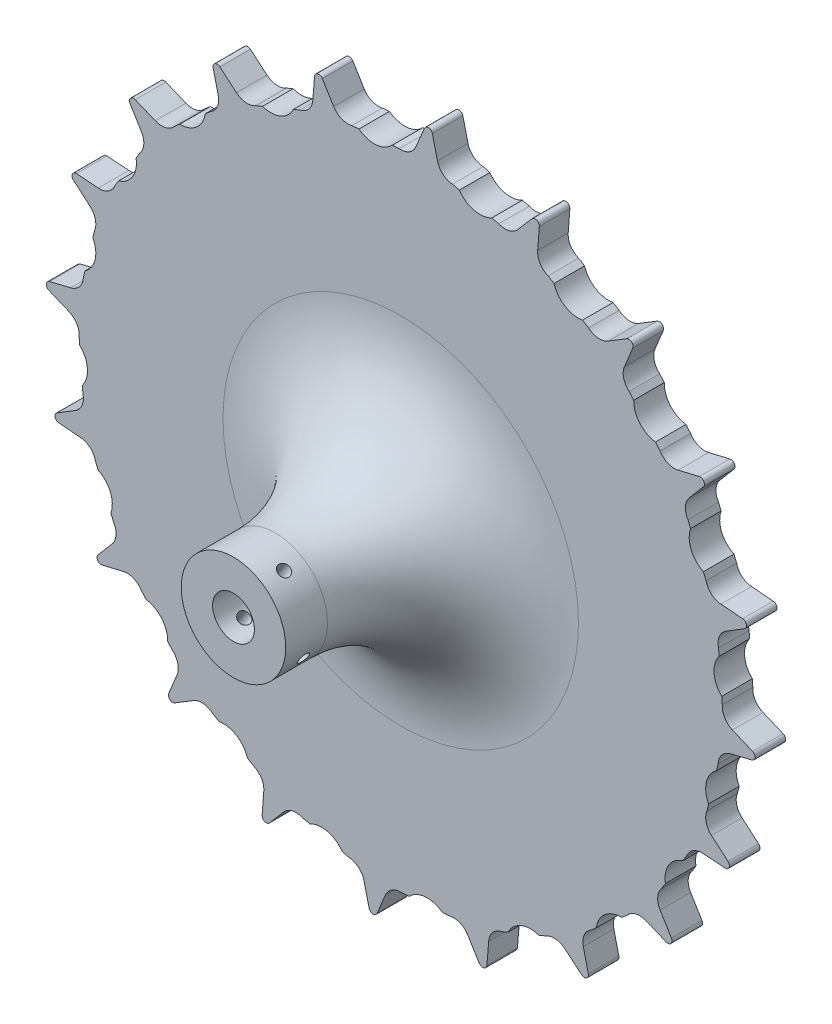
from build123d import *

# Parameters (mm, degrees)
BOSS_EXTRUDE1_DEPTH                 = 7.3
SKETCH2_R                           = 12.5
BOSS_EXTRUDE2_DEPTH                 = 40
FILLET1_R                           = 30
SKETCH3_R                           = 5
CUT_EXTRUDE1_DEPTH                  = 129.838593424
F_1_0MM_DOWEL_HOLE1_D               = 2.8
F_1_0MM_DOWEL_HOLE1_DEPTH           = 33.158795133
F_1_0MM_DOWEL_HOLE1_TIP             = 0.841204867
F_1_0MM_DOWEL_HOLE1_ON_FACE_2_D     = 2.8
F_1_0MM_DOWEL_HOLE1_ON_FACE_2_DEPTH = 33.158795133
F_1_0MM_DOWEL_HOLE1_ON_FACE_2_TIP   = 0.841204867
CUT_EXTRUDE2_DEPTH                  = 10
CIRPATTERN1_COUNT                   = 20


with BuildPart() as part:
    # Sketch1 → Boss-Extrude1 (new body)
    with BuildSketch(Plane.XY):
        with BuildLine():
            ThreePointArc((3.662609618, 79.321514688), (0, 76.88125), (-3.662609618, 79.321514688))
            Line((-3.662609618, 79.321514688), (-5.667701775, 84.126186191))
            ThreePointArc((-5.667701775, 84.126186191), (-6.669023137, 84.737973367), (-7.562311971, 83.977077135))
            Line((-7.562311971, 83.977077135), (-8.791101901, 78.917893592))
            ThreePointArc((-8.791101901, 78.917893592), (-12.026877215, 75.934714235), (-16.026135532, 77.77197684))
            Line((-16.026135532, 77.77197684), (-18.758157894, 82.203829344))
            ThreePointArc((-18.758157894, 82.203829344), (-19.842855928, 82.651443234), (-20.606116499, 81.760173735))
            Line((-20.606116499, 81.760173735), (-21.028347314, 76.571052042))
            ThreePointArc((-21.028347314, 76.571052042), (-23.757612799, 73.118413793), (-27.995044802, 74.307434811))
            Line((-27.995044802, 74.307434811), (-31.386725911, 78.2573414))
            ThreePointArc((-31.386725911, 78.2573414), (-32.528091751, 78.529760263), (-33.142530051, 77.530063512))
            Line((-33.142530051, 77.530063512), (-32.747805028, 72.338777067))
            ThreePointArc((-32.747805028, 72.338777067), (-34.903357108, 68.501695338), (-39.274623159, 69.013197125))
            Line((-39.274623159, 69.013197125), (-43.242448569, 72.38389799))
            ThreePointArc((-43.242448569, 72.38389799), (-44.412378001, 72.47441397), (-44.862864519, 71.390905818))
            Line((-44.862864519, 71.390905818), (-43.660903098, 66.325281321))
            ThreePointArc((-43.660903098, 66.325281321), (-45.189664928, 62.198237799), (-49.587129948, 62.019625484))
            Line((-49.587129948, 62.019625484), (-54.03339863, 64.728122783))
            ThreePointArc((-54.03339863, 64.728122783), (-55.203084108, 64.634507076), (-55.478526372, 63.49386709))
            Line((-55.478526372, 63.49386709), (-53.498924832, 58.678637028))
            ThreePointArc((-53.498924832, 58.678637028), (-54.363253221, 54.363253221), (-58.678637028, 53.498924832))
            Line((-58.678637028, 53.498924832), (-63.49386709, 55.478526372))
            ThreePointArc((-63.49386709, 55.478526372), (-64.634507076, 55.203084108), (-64.728122783, 54.03339863))
            Line((-64.728122783, 54.03339863), (-62.019625484, 49.587129948))
            ThreePointArc((-62.019625484, 49.587129948), (-62.198237799, 45.189664928), (-66.325281321, 43.660903098))
            Line((-66.325281321, 43.660903098), (-71.390905818, 44.862864519))
            ThreePointArc((-71.390905818, 44.862864519), (-72.47441397, 44.412378001), (-72.38389799, 43.242448569))
            Line((-72.38389799, 43.242448569), (-69.013197125, 39.274623159))
            ThreePointArc((-69.013197125, 39.274623159), (-68.501695338, 34.903357108), (-72.338777067, 32.747805028))
            Line((-72.338777067, 32.747805028), (-77.530063512, 33.142530051))
            ThreePointArc((-77.530063512, 33.142530051), (-78.529760263, 32.528091751), (-78.2573414, 31.386725911))
            Line((-78.2573414, 31.386725911), (-74.307434811, 27.995044802))
            ThreePointArc((-74.307434811, 27.995044802), (-73.118413793, 23.757612799), (-76.571052042, 21.028347314))
            Line((-76.571052042, 21.028347314), (-81.760173735, 20.606116499))
            ThreePointArc((-81.760173735, 20.606116499), (-82.651443234, 19.842855928), (-82.203829344, 18.758157894))
            Line((-82.203829344, 18.758157894), (-77.77197684, 16.026135532))
            ThreePointArc((-77.77197684, 16.026135532), (-75.934714235, 12.026877215), (-78.917893592, 8.791101901))
            Line((-78.917893592, 8.791101901), (-83.977077135, 7.562311971))
            ThreePointArc((-83.977077135, 7.562311971), (-84.737973367, 6.669023137), (-84.126186191, 5.667701775))
            Line((-84.126186191, 5.667701775), (-79.321514688, 3.662609618))
            ThreePointArc((-79.321514688, 3.662609618), (-76.88125, 0), (-79.321514688, -3.662609618))
            Line((-79.321514688, -3.662609618), (-84.126186191, -5.667701775))
            ThreePointArc((-84.126186191, -5.667701775), (-84.737973367, -6.669023137), (-83.977077135, -7.562311971))
            Line((-83.977077135, -7.562311971), (-78.917893592, -8.791101901))
            ThreePointArc((-78.917893592, -8.791101901), (-75.934714235, -12.026877215), (-77.77197684, -16.026135532))
            Line((-77.77197684, -16.026135532), (-82.203829344, -18.758157894))
            ThreePointArc((-82.203829344, -18.758157894), (-82.651443234, -19.842855928), (-81.760173735, -20.606116499))
            Line((-81.760173735, -20.606116499), (-76.571052042, -21.028347314))
            ThreePointArc((-76.571052042, -21.028347314), (-73.118413793, -23.757612799), (-74.307434811, -27.995044802))
            Line((-74.307434811, -27.995044802), (-78.2573414, -31.386725911))
            ThreePointArc((-78.2573414, -31.386725911), (-78.529760263, -32.528091751), (-77.530063512, -33.142530051))
            Line((-77.530063512, -33.142530051), (-72.338777067, -32.747805028))
            ThreePointArc((-72.338777067, -32.747805028), (-68.501695338, -34.903357108), (-69.013197125, -39.274623159))
            Line((-69.013197125, -39.274623159), (-72.38389799, -43.242448569))
            ThreePointArc((-72.38389799, -43.242448569), (-72.47441397, -44.412378001), (-71.390905818, -44.862864519))
            Line((-71.390905818, -44.862864519), (-66.325281321, -43.660903098))
            ThreePointArc((-66.325281321, -43.660903098), (-62.198237799, -45.189664928), (-62.019625484, -49.587129948))
            Line((-62.019625484, -49.587129948), (-64.728122783, -54.03339863))
            ThreePointArc((-64.728122783, -54.03339863), (-64.634507076, -55.203084108), (-63.49386709, -55.478526372))
            Line((-63.49386709, -55.478526372), (-58.678637028, -53.498924832))
            ThreePointArc((-58.678637028, -53.498924832), (-54.363253221, -54.363253221), (-53.498924832, -58.678637028))
            Line((-53.498924832, -58.678637028), (-55.478526372, -63.49386709))
            ThreePointArc((-55.478526372, -63.49386709), (-55.203084108, -64.634507076), (-54.03339863, -64.728122783))
            Line((-54.03339863, -64.728122783), (-49.587129948, -62.019625484))
            ThreePointArc((-49.587129948, -62.019625484), (-45.189664928, -62.198237799), (-43.660903098, -66.325281321))
            Line((-43.660903098, -66.325281321), (-44.862864519, -71.390905818))
            ThreePointArc((-44.862864519, -71.390905818), (-44.412378001, -72.47441397), (-43.242448569, -72.38389799))
            Line((-43.242448569, -72.38389799), (-39.274623159, -69.013197125))
            ThreePointArc((-39.274623159, -69.013197125), (-34.903357108, -68.501695338), (-32.747805028, -72.338777067))
            Line((-32.747805028, -72.338777067), (-33.142530051, -77.530063512))
            ThreePointArc((-33.142530051, -77.530063512), (-32.528091751, -78.529760263), (-31.386725911, -78.2573414))
            Line((-31.386725911, -78.2573414), (-27.995044802, -74.307434811))
            ThreePointArc((-27.995044802, -74.307434811), (-23.757612799, -73.118413793), (-21.028347314, -76.571052042))
            Line((-21.028347314, -76.571052042), (-20.606116499, -81.760173735))
            ThreePointArc((-20.606116499, -81.760173735), (-19.842855928, -82.651443234), (-18.758157894, -82.203829344))
            Line((-18.758157894, -82.203829344), (-16.026135532, -77.77197684))
            ThreePointArc((-16.026135532, -77.77197684), (-12.026877215, -75.934714235), (-8.791101901, -78.917893592))
            Line((-8.791101901, -78.917893592), (-7.562311971, -83.977077135))
            ThreePointArc((-7.562311971, -83.977077135), (-6.669023137, -84.737973367), (-5.667701775, -84.126186191))
            Line((-5.667701775, -84.126186191), (-3.662609618, -79.321514688))
            ThreePointArc((-3.662609618, -79.321514688), (0, -76.88125), (3.662609618, -79.321514688))
            Line((3.662609618, -79.321514688), (5.667701775, -84.126186191))
            ThreePointArc((5.667701775, -84.126186191), (6.669023137, -84.737973367), (7.562311971, -83.977077135))
            Line((7.562311971, -83.977077135), (8.791101901, -78.917893592))
            ThreePointArc((8.791101901, -78.917893592), (12.026877215, -75.934714235), (16.026135532, -77.77197684))
            Line((16.026135532, -77.77197684), (18.758157894, -82.203829344))
            ThreePointArc((18.758157894, -82.203829344), (19.842855928, -82.651443234), (20.606116499, -81.760173735))
            Line((20.606116499, -81.760173735), (21.028347314, -76.571052042))
            ThreePointArc((21.028347314, -76.571052042), (23.757612799, -73.118413793), (27.995044802, -74.307434811))
            Line((27.995044802, -74.307434811), (31.386725911, -78.2573414))
            ThreePointArc((31.386725911, -78.2573414), (32.528091751, -78.529760263), (33.142530051, -77.530063512))
            Line((33.142530051, -77.530063512), (32.747805028, -72.338777067))
            ThreePointArc((32.747805028, -72.338777067), (34.903357108, -68.501695338), (39.274623159, -69.013197125))
            Line((39.274623159, -69.013197125), (43.242448569, -72.38389799))
            ThreePointArc((43.242448569, -72.38389799), (44.412378001, -72.47441397), (44.862864519, -71.390905818))
            Line((44.862864519, -71.390905818), (43.660903098, -66.325281321))
            ThreePointArc((43.660903098, -66.325281321), (45.189664928, -62.198237799), (49.587129948, -62.019625484))
            Line((49.587129948, -62.019625484), (54.03339863, -64.728122783))
            ThreePointArc((54.03339863, -64.728122783), (55.203084108, -64.634507076), (55.478526372, -63.49386709))
            Line((55.478526372, -63.49386709), (53.498924832, -58.678637028))
            ThreePointArc((53.498924832, -58.678637028), (54.363253221, -54.363253221), (58.678637028, -53.498924832))
            Line((58.678637028, -53.498924832), (63.49386709, -55.478526372))
            ThreePointArc((63.49386709, -55.478526372), (64.634507076, -55.203084108), (64.728122783, -54.03339863))
            Line((64.728122783, -54.03339863), (62.019625484, -49.587129948))
            ThreePointArc((62.019625484, -49.587129948), (62.198237799, -45.189664928), (66.325281321, -43.660903098))
            Line((66.325281321, -43.660903098), (71.390905818, -44.862864519))
            ThreePointArc((71.390905818, -44.862864519), (72.47441397, -44.412378001), (72.38389799, -43.242448569))
            Line((72.38389799, -43.242448569), (69.013197125, -39.274623159))
            ThreePointArc((69.013197125, -39.274623159), (68.501695338, -34.903357108), (72.338777067, -32.747805028))
            Line((72.338777067, -32.747805028), (77.530063512, -33.142530051))
            ThreePointArc((77.530063512, -33.142530051), (78.529760263, -32.528091751), (78.2573414, -31.386725911))
            Line((78.2573414, -31.386725911), (74.307434811, -27.995044802))
            ThreePointArc((74.307434811, -27.995044802), (73.118413793, -23.757612799), (76.571052042, -21.028347314))
            Line((76.571052042, -21.028347314), (81.760173735, -20.606116499))
            ThreePointArc((81.760173735, -20.606116499), (82.651443234, -19.842855928), (82.203829344, -18.758157894))
            Line((82.203829344, -18.758157894), (77.77197684, -16.026135532))
            ThreePointArc((77.77197684, -16.026135532), (75.934714235, -12.026877215), (78.917893592, -8.791101901))
            Line((78.917893592, -8.791101901), (83.977077135, -7.562311971))
            ThreePointArc((83.977077135, -7.562311971), (84.737973367, -6.669023137), (84.126186191, -5.667701775))
            Line((84.126186191, -5.667701775), (79.321514688, -3.662609618))
            ThreePointArc((79.321514688, -3.662609618), (76.88125, 0), (79.321514688, 3.662609618))
            Line((79.321514688, 3.662609618), (84.126186191, 5.667701775))
            ThreePointArc((84.126186191, 5.667701775), (84.737973367, 6.669023137), (83.977077135, 7.562311971))
            Line((83.977077135, 7.562311971), (78.917893592, 8.791101901))
            ThreePointArc((78.917893592, 8.791101901), (75.934714235, 12.026877215), (77.77197684, 16.026135532))
            Line((77.77197684, 16.026135532), (82.203829344, 18.758157894))
            ThreePointArc((82.203829344, 18.758157894), (82.651443234, 19.842855928), (81.760173735, 20.606116499))
            Line((81.760173735, 20.606116499), (76.571052042, 21.028347314))
            ThreePointArc((76.571052042, 21.028347314), (73.118413793, 23.757612799), (74.307434811, 27.995044802))
            Line((74.307434811, 27.995044802), (78.2573414, 31.386725911))
            ThreePointArc((78.2573414, 31.386725911), (78.529760263, 32.528091751), (77.530063512, 33.142530051))
            Line((77.530063512, 33.142530051), (72.338777067, 32.747805028))
            ThreePointArc((72.338777067, 32.747805028), (68.501695338, 34.903357108), (69.013197125, 39.274623159))
            Line((69.013197125, 39.274623159), (72.38389799, 43.242448569))
            ThreePointArc((72.38389799, 43.242448569), (72.47441397, 44.412378001), (71.390905818, 44.862864519))
            Line((71.390905818, 44.862864519), (66.325281321, 43.660903098))
            ThreePointArc((66.325281321, 43.660903098), (62.198237799, 45.189664928), (62.019625484, 49.587129948))
            Line((62.019625484, 49.587129948), (64.728122783, 54.03339863))
            ThreePointArc((64.728122783, 54.03339863), (64.634507076, 55.203084108), (63.49386709, 55.478526372))
            Line((63.49386709, 55.478526372), (58.678637028, 53.498924832))
            ThreePointArc((58.678637028, 53.498924832), (54.363253221, 54.363253221), (53.498924832, 58.678637028))
            Line((53.498924832, 58.678637028), (55.478526372, 63.49386709))
            ThreePointArc((55.478526372, 63.49386709), (55.203084108, 64.634507076), (54.03339863, 64.728122783))
            Line((54.03339863, 64.728122783), (49.587129948, 62.019625484))
            ThreePointArc((49.587129948, 62.019625484), (45.189664928, 62.198237799), (43.660903098, 66.325281321))
            Line((43.660903098, 66.325281321), (44.862864519, 71.390905818))
            ThreePointArc((44.862864519, 71.390905818), (44.412378001, 72.47441397), (43.242448569, 72.38389799))
            Line((43.242448569, 72.38389799), (39.274623159, 69.013197125))
            ThreePointArc((39.274623159, 69.013197125), (34.903357108, 68.501695338), (32.747805028, 72.338777067))
            Line((32.747805028, 72.338777067), (33.142530051, 77.530063512))
            ThreePointArc((33.142530051, 77.530063512), (32.528091751, 78.529760263), (31.386725911, 78.2573414))
            Line((31.386725911, 78.2573414), (27.995044802, 74.307434811))
            ThreePointArc((27.995044802, 74.307434811), (23.757612799, 73.118413793), (21.028347314, 76.571052042))
            Line((21.028347314, 76.571052042), (20.606116499, 81.760173735))
            ThreePointArc((20.606116499, 81.760173735), (19.842855928, 82.651443234), (18.758157894, 82.203829344))
            Line((18.758157894, 82.203829344), (16.026135532, 77.77197684))
            ThreePointArc((16.026135532, 77.77197684), (12.026877215, 75.934714235), (8.791101901, 78.917893592))
            Line((8.791101901, 78.917893592), (7.562311971, 83.977077135))
            ThreePointArc((7.562311971, 83.977077135), (6.669023137, 84.737973367), (5.667701775, 84.126186191))
            Line((5.667701775, 84.126186191), (3.662609618, 79.321514688))
        make_face()
    extrude(amount=BOSS_EXTRUDE1_DEPTH)

    # Sketch2 → Boss-Extrude2 (add)
    with BuildSketch(Plane.XY.offset(7.3)):
        Circle(SKETCH2_R)
    extrude(amount=BOSS_EXTRUDE2_DEPTH)

    # Fillet1
    fillet1_edges = [part.edges().sort_by_distance(p)[0] for p in [
        (-12.5, 0, 7.3),
    ]]
    fillet(fillet1_edges, radius=FILLET1_R)

    # Sketch3 → Cut-Extrude1 (cut, through all)
    with BuildSketch(Plane.XY.offset(47.3)):
        Circle(SKETCH3_R)
    extrude(amount=-CUT_EXTRUDE1_DEPTH, mode=Mode.SUBTRACT)

    # Ø1.0mm Dowel Hole1
    with Locations(Plane(origin=(-6.81763654, -10.477109907, 42.020116055), x_dir=(-0.838168792578, 0.545410923202, 0), z_dir=(-0.545410923202, -0.838168792578, 0))):
        with Locations((0, 0)):
            Hole(F_1_0MM_DOWEL_HOLE1_D / 2, depth=F_1_0MM_DOWEL_HOLE1_DEPTH)
            with Locations((0, 0, -(F_1_0MM_DOWEL_HOLE1_DEPTH + F_1_0MM_DOWEL_HOLE1_TIP / 2))):  # 118° drill point
                Cone(0, F_1_0MM_DOWEL_HOLE1_D / 2, F_1_0MM_DOWEL_HOLE1_TIP, mode=Mode.SUBTRACT)

    # Ø1.0mm Dowel Hole1 on face 2
    with Locations(Plane(origin=(-11.068439798, 5.808583342, 41.658255729), x_dir=(-0.464687003812, -0.885475007264, 0), z_dir=(-0.885475007264, 0.464687003812, 0))):
        with Locations((0, 0)):
            Hole(F_1_0MM_DOWEL_HOLE1_ON_FACE_2_D / 2, depth=F_1_0MM_DOWEL_HOLE1_ON_FACE_2_DEPTH)
            with Locations((0, 0, -(F_1_0MM_DOWEL_HOLE1_ON_FACE_2_DEPTH + F_1_0MM_DOWEL_HOLE1_ON_FACE_2_TIP / 2))):  # 118° drill point
                Cone(0, F_1_0MM_DOWEL_HOLE1_ON_FACE_2_D / 2, F_1_0MM_DOWEL_HOLE1_ON_FACE_2_TIP, mode=Mode.SUBTRACT)

    # Sketch5 → Cut-Extrude2 (cut)
    with BuildSketch(Plane(origin=(0, 0, 0), x_dir=(-1, 0, 0), z_dir=(0, 0, -1))):
        with BuildLine():
            Line((-0.961651803, 76.999519203), (2.029100198, 76.764141915))
            ThreePointArc((2.029100198, 76.764141915), (5.896894701, 74.927151382), (10.004438868, 76.13646915))
            Line((10.004438868, 76.13646915), (12.995190869, 75.901091862))
            Line((12.995190869, 75.901091862), (13.647444473, 84.188759697))
            Line((13.647444473, 84.188759697), (-0.309398199, 85.287187037))
            Line((-0.309398199, 85.287187037), (-0.961651803, 76.999519203))
        make_face()
    cut_extrude2 = extrude(amount=-CUT_EXTRUDE2_DEPTH, mode=Mode.SUBTRACT)

    # CirPattern1: Cut-Extrude2 ×20 about axis
    cirpattern1_axis = Axis((0, 0, 0), (0, 0, 1))
    for i in range(1, CIRPATTERN1_COUNT):
        add(cut_extrude2.rotate(cirpattern1_axis, i * 360 / CIRPATTERN1_COUNT), mode=Mode.SUBTRACT)


solid = part.part
